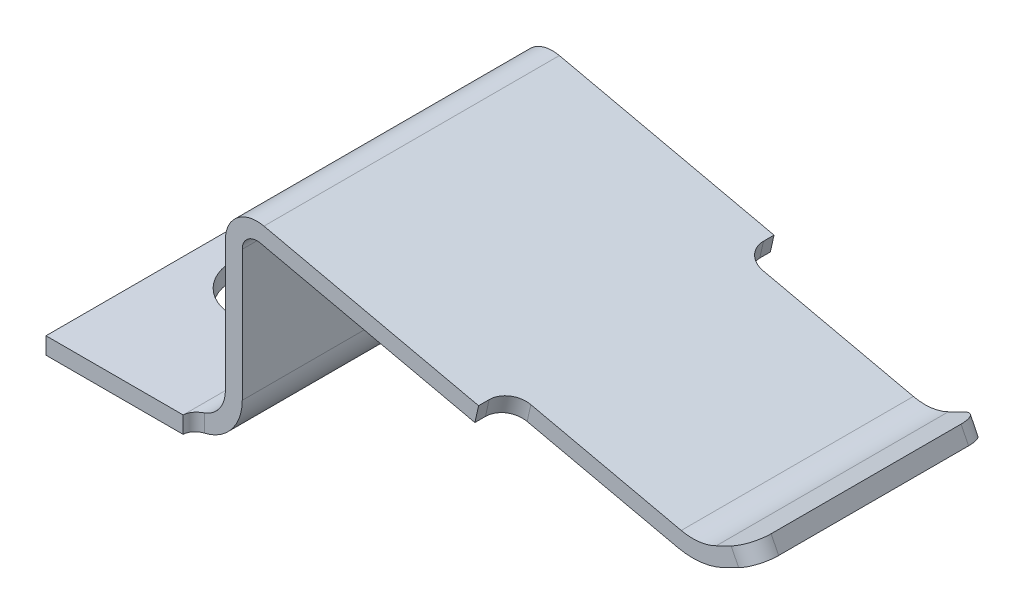
from build123d import *

# Parameters (mm, degrees)
EXTRUDE_1_DEPTH          = 15
CUT_EXTRUDE_1_DEPTH      = 15
CUT_EXTRUDE_1_DEPTH_BACK = 15
SKETCH_2_R               = 2.25
CUT_EXTRUDE_2_DEPTH      = 1.5
CUT_EXTRUDE_3_DEPTH      = 1.5
FILLET_1_R               = 0.5
FILLET_2_R               = 1


with BuildPart() as part:
    # Эскиз1 → Вытянуть1 (new body)
    with BuildSketch(Plane.XY):
        with BuildLine():
            Line((-25.229060352, 2.359412), (-25.229060352, 8.559412))
            ThreePointArc((-25.229060352, 8.559412), (-24.666370719, 9.730500928), (-23.400461317, 10.022977057))
            Line((-23.400461317, 10.022977057), (-5.12659913, 5.920136906))
            ThreePointArc((-5.12659913, 5.920136906), (-4.279542261, 5.877403833), (-3.466943303, 6.120332607))
            Line((-3.466943303, 6.120332607), (-1.866464924, 6.915175876))
            Line((-1.866464924, 6.915175876), (-1.510627877, 6.19867047))
            Line((-1.510627877, 6.19867047), (-3.111106257, 5.403827201))
            ThreePointArc((-3.111106257, 5.403827201), (-4.183736881, 5.083161219), (-5.301851949, 5.139568876))
            Line((-5.301851949, 5.139568876), (-23.575714136, 9.242409026))
            ThreePointArc((-23.575714136, 9.242409026), (-24.166471856, 9.105920166), (-24.429060352, 8.559412))
            Line((-24.429060352, 8.559412), (-24.429060352, 2.359412))
            ThreePointArc((-24.429060352, 2.359412), (-25.102714755, 0.733066403), (-26.729060352, 0.059412))
            Line((-26.729060352, 0.059412), (-33.229060352, 0.059412))
            Line((-33.229060352, 0.059412), (-33.229060352, 0.859412))
            Line((-33.229060352, 0.859412), (-26.729060352, 0.859412))
            ThreePointArc((-26.729060352, 0.859412), (-25.66840018, 1.298751828), (-25.229060352, 2.359412))
        make_face()
    extrude(amount=EXTRUDE_1_DEPTH)

    # Эскиз2 → Вырез-Вытянуть1 (cut, two sides: drawn at the far end of the back side and taken through both)
    with BuildSketch(Plane(origin=(0, 0.859412, 0), x_dir=(1, 0, 0), z_dir=(0, 1, 0)).offset(-CUT_EXTRUDE_1_DEPTH_BACK)):
        with Locations(Location((-29.629060352, -7.5, 0), (0, 0, 90))):
            Circle(SKETCH_2_R)
        Polygon((-13.229060352, -0.5), (-13.229060352, -2), (-0.791842207, -2), (-0.791842207, 0), (-26.729060352, 0), (-26.729060352, -0.5), align=None)
        Polygon((-26.729060352, -15), (-0.791842207, -15), (-0.791842207, -13), (-13.229060352, -13), (-13.229060352, -14.5), (-26.729060352, -14.5), align=None)
    extrude(amount=CUT_EXTRUDE_1_DEPTH + CUT_EXTRUDE_1_DEPTH_BACK, mode=Mode.SUBTRACT)

    # Эскиз3 → Вырез-Вытянуть2 (cut)
    with BuildSketch(Plane.XY.offset(14.5)):
        Polygon((-13.229060352, 7.739298224), (-13.229060352, 6.919382502), (-13.40431317, 6.958730194), align=None)
    extrude(amount=-CUT_EXTRUDE_2_DEPTH, mode=Mode.SUBTRACT)

    # Эскиз4 → Вырез-Вытянуть3 (cut)
    with BuildSketch(Plane(origin=(0, 0, 0.5), x_dir=(-1, 0, 0), z_dir=(0, 0, -1))):
        Polygon((13.229060352, 7.739298224), (13.229060352, 6.919382502), (13.40431317, 6.958730194), align=None)
    extrude(amount=-CUT_EXTRUDE_3_DEPTH, mode=Mode.SUBTRACT)

    # Скругление1
    # the kernel refuses this fillet: 0.5 mm, written as the material it adds along each edge
    with BuildSketch(Plane(origin=(-26.729060352, 2.109412, 14.5), x_dir=(0, 0, 1), z_dir=(0, -1, 0))) as fillet_1_piece_1_section:
        with BuildLine():
            CenterArc((FILLET_1_R, -FILLET_1_R), FILLET_1_R, 90, 90)
            Line((0, -FILLET_1_R), (0, 0))
            Line((0, 0), (FILLET_1_R, 0))
        make_face()
    fillet_1_piece_1 = extrude(amount=3.3, mode=Mode.PRIVATE)
    fillet_1_piece_1 = fillet_1_piece_1 - Plane(origin=(-26.729060352, 2.359412, 14.543282734), x_dir=(0, -1, 0), z_dir=(0, 0, -1)) * Cylinder(1.5, 9, mode=Mode.PRIVATE)
    fillet_1_piece_1 = fillet_1_piece_1 & Plane(origin=(-26.729060352, 2.359412, 14.543282734), x_dir=(1, 0, 0), z_dir=(0, 0, -1)) * Cylinder(2.3, 9, mode=Mode.PRIVATE)
    add(fillet_1_piece_1)
    with BuildSketch(Plane(origin=(-26.729060352, 2.109412, 0.5), x_dir=(0, 0, -1), z_dir=(0, -1, 0))) as fillet_1_piece_2_section:
        with BuildLine():
            CenterArc((FILLET_1_R, FILLET_1_R), FILLET_1_R, 180, 90)
            Line((0, FILLET_1_R), (0, 0))
            Line((0, 0), (FILLET_1_R, 0))
        make_face()
    fillet_1_piece_2 = extrude(amount=3.3, mode=Mode.PRIVATE)
    fillet_1_piece_2 = fillet_1_piece_2 - Plane(origin=(-26.729060352, 2.359412, 0.456717266), x_dir=(0, -1, 0), z_dir=(0, 0, -1)) * Cylinder(1.5, 9, mode=Mode.PRIVATE)
    fillet_1_piece_2 = fillet_1_piece_2 & Plane(origin=(-26.729060352, 2.359412, 0.456717266), x_dir=(1, 0, 0), z_dir=(0, 0, -1)) * Cylinder(2.3, 9, mode=Mode.PRIVATE)
    add(fillet_1_piece_2)

    # Скругление2
    fillet_2_edges = [part.edges().sort_by_distance(p)[0] for p in [
        (-1.6885464, 6.556923173, 13),
        (-13.316686761, 7.349014209, 13),
        (-13.316686761, 7.349014209, 2),
        (-1.6885464, 6.556923173, 2),
    ]]
    fillet(fillet_2_edges, radius=FILLET_2_R)


solid = part.part
